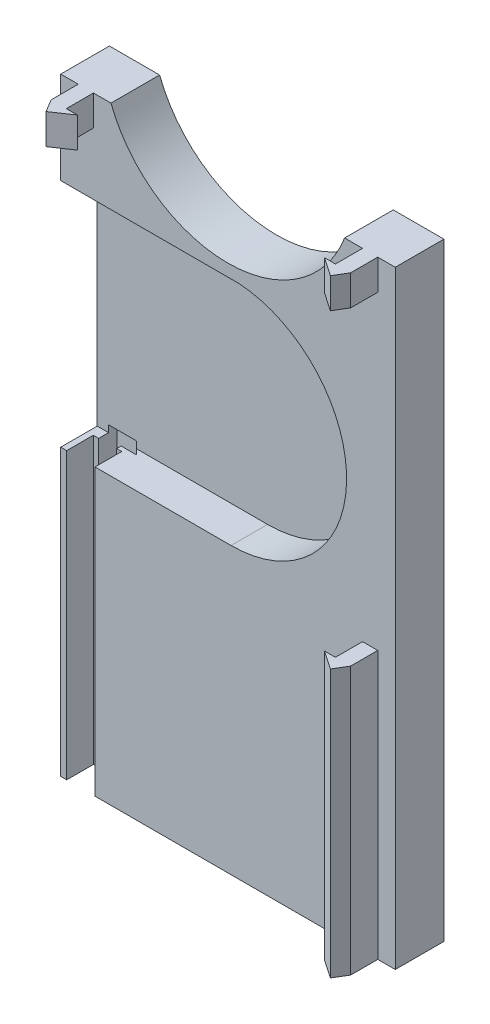
from build123d import *

# Parameters (mm, degrees)
SKETCH1_W           = 55
SKETCH1_H           = 8
BOSS_EXTRUDE1_DEPTH = 100
SKETCH6_W           = 6
SKETCH6_H           = 37.952212291
CUT_EXTRUDE1_DEPTH  = 47
CUT_EXTRUDE2_DEPTH  = 48
CUT_EXTRUDE3_DEPTH  = 8
BOSS_EXTRUDE2_DEPTH = 5
BOSS_EXTRUDE3_DEPTH = 6
BOSS_EXTRUDE4_DEPTH = 44


with BuildPart() as part:
    # Sketch1 → Boss-Extrude1 (new body)
    with BuildSketch(Plane(origin=(0, 0, 0), x_dir=(1, 0, 0), z_dir=(0, 1, 0))):
        Rectangle(SKETCH1_W, SKETCH1_H)
    extrude(amount=BOSS_EXTRUDE1_DEPTH)

    # Sketch6 → Cut-Extrude1 (cut)
    with BuildSketch(Plane.ZY.offset(27.5)):
        with Locations((1, 65.855873927)):
            Rectangle(SKETCH6_W, SKETCH6_H)
    extrude(amount=-CUT_EXTRUDE1_DEPTH, mode=Mode.SUBTRACT)

    # Sketch7 → Cut-Extrude2 (cut)
    with BuildSketch(Plane.XZ):
        Polygon((-26.518957112, 4), (-21.869195033, 4), (-21.869195033, -0.39283021), (-22.697803968, -0.39283021), (-22.697803968, -1.127681143), (-20.210888637, -1.127681143), (-22.40438754, -3.359766869), (-25.631664404, -3.412588624), (-25.631664404, -0.373718036), (-26.518957112, -0.373718036), align=None)
    extrude(amount=-CUT_EXTRUDE2_DEPTH, mode=Mode.SUBTRACT)

    # Sketch8 → Cut-Extrude3 (cut)
    with BuildSketch(Plane(origin=(0, 0, -4), x_dir=(-1, 0, 0), z_dir=(0, 0, -1))):
        with BuildLine():
            Line((-19.171628344, 100), (19.243902902, 100))
            ThreePointArc((19.243902902, 100), (0.036137279, 86.824254905), (-19.171628344, 100))
        make_face()
    extrude(amount=-CUT_EXTRUDE3_DEPTH, mode=Mode.SUBTRACT)

    # Sketch9 → Boss-Extrude2 (add)
    with BuildSketch(Plane(origin=(0, 100, 0), x_dir=(1, 0, 0), z_dir=(0, 1, 0))):
        Polygon((-22.121951451, 0.462591799), (-24.621951451, 0.462591799), (-24.621951451, -8.462591799), (-23.371951451, -10.537408201), (-20.321951451, -8.462591799), (-22.121951451, -8.462591799), align=None)
        Polygon((24.621951451, -8.462591799), (23.371951451, -10.537408201), (20.321951451, -8.462591799), (22.121951451, -8.462591799), (22.121951451, 0.462591799), (24.621951451, 0.462591799), align=None)
    extrude(amount=-BOSS_EXTRUDE2_DEPTH)

    # Sketch11 → Boss-Extrude3 (add)
    with BuildSketch(Plane.XY.offset(-2)):
        with BuildLine():
            Line((19.5, 84.831980072), (1.846717973, 84.831980072))
            ThreePointArc((1.846717973, 84.831980072), (14.403014808, 78.829909837), (19.5, 65.879767781))
            Line((19.5, 65.879767781), (19.5, 84.831980072))
        make_face()
        with BuildLine():
            Line((19.5, 46.879767781), (19.5, 65.879767781))
            ThreePointArc((19.5, 65.879767781), (13.935028843, 52.444738939), (0.5, 46.879767781))
            Line((0.5, 46.879767781), (19.5, 46.879767781))
        make_face()
    extrude(amount=BOSS_EXTRUDE3_DEPTH)


with BuildPart() as body_2:
    # Sketch12 → Boss-Extrude4 (new body)
    with BuildSketch(Plane.XZ):
        Polygon((24.621951451, 4), (24.621951451, 8.462591799), (23.371951451, 10.537408201), (20.321951451, 8.462591799), (22.121951451, 8.462591799), (22.121951451, 4), align=None)
    extrude(amount=-BOSS_EXTRUDE4_DEPTH)


solid = Compound([part.part, body_2.part])
